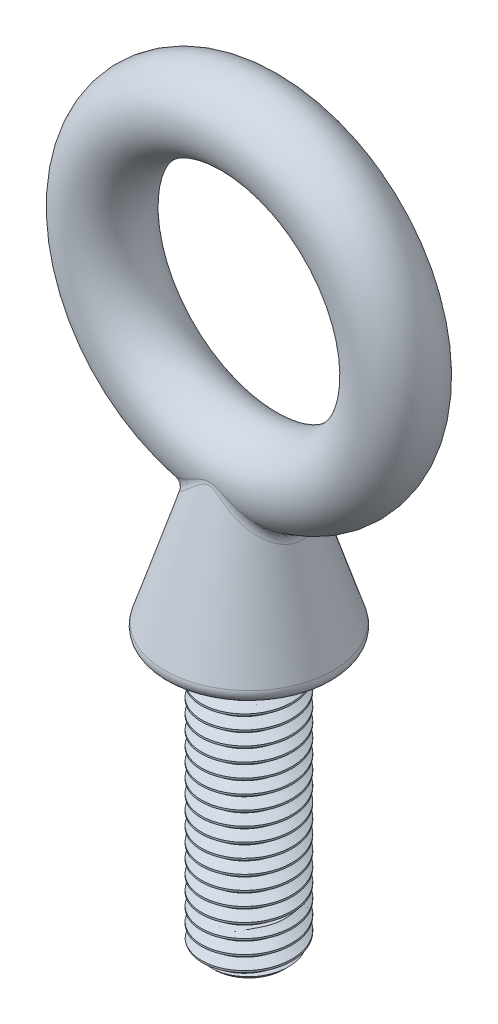
from build123d import *
from build123d.topology import SkipClean

# Parameters (mm, degrees)
BOSS_EXTRUDE1_START = -42.06875
SKETCH2_R           = 6.35
BOSS_EXTRUDE1_DEPTH = 38.1
CUT_SWEEP1_PITCH    = 1.953846154
SKETCH5_OUTSIDE_W   = 103.412
SKETCH5_OUTSIDE_H   = 103.412
SKETCH5_OUTSIDE_R   = 4.869429646
CUT_EXTRUDE1_DEPTH  = 40.144029049
CUT_EXTRUDE1_DRAFT  = -45
SKETCH6_R           = 5.55625
FILLET1_R           = 1.3890625


with BuildPart() as part:
    # Sketch2 → Boss-Extrude1 (new body)
    with BuildSketch(Plane(origin=(0, 0, 0), x_dir=(1, 0, 0), z_dir=(0, 1, 0)).offset(BOSS_EXTRUDE1_START)):
        with Locations(Location((0, 0, 0), (0, 0, 270))):
            Circle(SKETCH2_R)
    extrude(amount=-BOSS_EXTRUDE1_DEPTH)

    # Cut-Sweep1: the profile of Sketch4 screwed along a right-hand helix of 20.5 turns, 10 arcs to a turn; built about Z, then put on its axis
    cut_sweep1_z = Axis((0, 0, 0), (0, 0, 1))
    cut_sweep1_corners = [(6.455755025, 0, 0.061057692), (5.080939697, 0, -0.732692308), (5.080939697, 0, -0.976923077), (6.455755025, 0, -1.770673077)]
    with BuildLine(mode=Mode.PRIVATE) as cut_sweep1_profile:
        Line(cut_sweep1_corners[0], cut_sweep1_corners[1])
        Line(cut_sweep1_corners[1], cut_sweep1_corners[2])
        Line(cut_sweep1_corners[2], cut_sweep1_corners[3])
        Line(cut_sweep1_corners[3], cut_sweep1_corners[0])
    cut_sweep1_cap = Face(cut_sweep1_profile.wire())
    cut_sweep1_turn_angles = [0, 18, 36, 54, 72, 90, 108, 126, 144, 162, 180, 198, 216, 234, 252, 270, 288, 306, 324, 342, 360]
    cut_sweep1_turn_weights = [1, 0.9510565162951535, 1, 0.9510565162951535, 1, 0.9510565162951535, 1, 0.9510565162951535, 1, 0.9510565162951535, 1, 0.9510565162951535, 1, 0.9510565162951535, 1, 0.9510565162951535, 1, 0.9510565162951535, 1, 0.9510565162951535, 1]
    cut_sweep1_turn_rails = [Edge.make_bspline([Vector(p[0], p[1], 0).rotate(cut_sweep1_z, cut_sweep1_turn_angles[k]) / cut_sweep1_turn_weights[k] + Vector(0, 0, p[2] + CUT_SWEEP1_PITCH * cut_sweep1_turn_angles[k] / 360) for k in range(21)], [0, 0, 0, 1, 1, 2, 2, 3, 3, 4, 4, 5, 5, 6, 6, 7, 7, 8, 8, 9, 9, 10, 10, 10], 2, cut_sweep1_turn_weights) for p in cut_sweep1_corners]
    cut_sweep1_turn_sides = [Face.make_surface_from_curves(cut_sweep1_turn_rails[p[0]], cut_sweep1_turn_rails[p[1]]) for p in [(0, 1), (1, 2), (2, 3), (3, 0)]]
    cut_sweep1_last_angles = [7200, 7218, 7236, 7254, 7272, 7290, 7308, 7326, 7344, 7362, 7380]
    cut_sweep1_last_weights = [1, 0.9510565162951535, 1, 0.9510565162951535, 1, 0.9510565162951535, 1, 0.9510565162951535, 1, 0.951056516295291, 1]
    cut_sweep1_last_rails = [Edge.make_bspline([Vector(p[0], p[1], 0).rotate(cut_sweep1_z, cut_sweep1_last_angles[k]) / cut_sweep1_last_weights[k] + Vector(0, 0, p[2] + CUT_SWEEP1_PITCH * cut_sweep1_last_angles[k] / 360) for k in range(11)], [0, 0, 0, 1, 1, 2, 2, 3, 3, 4, 4, 5, 5, 5], 2, cut_sweep1_last_weights) for p in cut_sweep1_corners]
    cut_sweep1_last_sides = [Face.make_surface_from_curves(cut_sweep1_last_rails[p[0]], cut_sweep1_last_rails[p[1]]) for p in [(0, 1), (1, 2), (2, 3), (3, 0)]]
    cut_sweep1 = Plane(origin=(0, -80.16875, 0), x_dir=(1, 0, 0), z_dir=(0, 1, 0)) * Solid(Shell([*[p.moved(Location((0, 0, CUT_SWEEP1_PITCH * i))) for i in range(20) for p in cut_sweep1_turn_sides], *cut_sweep1_last_sides, cut_sweep1_cap, cut_sweep1_cap.rotate(cut_sweep1_z, 7380).moved(Location((0, 0, CUT_SWEEP1_PITCH * 7380 / 360)))]))
    add(cut_sweep1, mode=Mode.SUBTRACT)


with BuildPart() as cut_extrude1_tool:
    # Sketch5 outside → Cut-Extrude1 (with draft: the straight prism first)
    with BuildSketch(Plane.XZ.offset(80.16875)):
        Rectangle(SKETCH5_OUTSIDE_W, SKETCH5_OUTSIDE_H)
        Circle(SKETCH5_OUTSIDE_R, mode=Mode.SUBTRACT)
    extrude(amount=-CUT_EXTRUDE1_DEPTH)
    # Cut-Extrude1: the draft: its side faces are tilted about the plane it starts from
    cut_extrude1_sides = [cut_extrude1_tool.faces().sort_by_distance(p)[0] for p in [
        (0, -60.096735476, -51.706),
        (51.706, -60.096735476, 0),
        (0, -60.096735476, 51.706),
        (-51.706, -60.096735476, 0),
        (-4.869429646, -60.096735476, 0),
    ]]
    draft(cut_extrude1_sides, Plane.XZ.offset(80.16875), CUT_EXTRUDE1_DRAFT)


with BuildPart() as part_1:
    add(part.part)

    # Cut-Extrude1: cut by cut_extrude1_tool
    add(cut_extrude1_tool.part, mode=Mode.SUBTRACT)



with BuildPart() as body_2:
    # Sketch6 → Revolve1 (revolve)
    with BuildSketch(Plane(origin=(0, 0, 0), x_dir=(0, 0, -1), z_dir=(1, 0, 0)), mode=Mode.PRIVATE) as revolve1_sk:
        with Locations((0, 20.6375)):
            Circle(SKETCH6_R)
    revolve(revolve1_sk.sketch.rotate(Axis((0, 0, -7.63984375), (0, 0, 1)), 90), axis=Axis((0, 0, -7.63984375), (0, 0, 1)))


with BuildPart() as part_2:
    with SkipClean():  # the faces are left unmerged after this step: merging them gives an invalid solid
        add(part_1.part)

        add(body_2.part)  # Revolve2 merges body 2
        # Sketch8 → Revolve2 (revolve)
        with BuildSketch(Plane.XY, mode=Mode.PRIVATE) as revolve2_sk:
            with BuildLine():
                Line((0, -42.06875), (0, -20.6375))
                Line((0, -20.6375), (-5.55625, -20.6375))
                Line((-5.55625, -20.6375), (-11.840048893, -40.255974903))
                ThreePointArc((-11.840048893, -40.255974903), (-11.639252094, -41.498507184), (-10.5171875, -42.06875))
                Line((-10.5171875, -42.06875), (0, -42.06875))
            make_face()
        revolve(revolve2_sk.sketch.rotate(Axis((0, -42.06875, 0), (0, 1, 0)), 180), axis=Axis((0, -42.06875, 0), (0, 1, 0)))

    # Fillet1
    fillet1_edges = [part_2.edges().sort_by_distance(p)[0] for p in [
        (4.63884165, -23.45226854, 4.492726851),
    ]]
    fillet(fillet1_edges, radius=FILLET1_R)


solid = part_2.part
